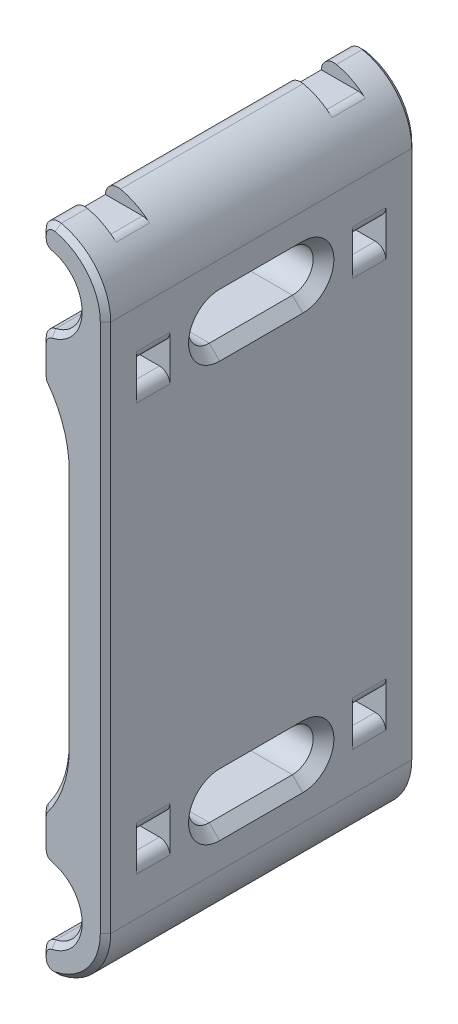
from build123d import *

# Parameters (mm, degrees)
CROQUIS1_R                 = 3.25
SALIENTE_EXTRUIR1_DEPTH    = 30
REDONDEO1_R                = 10
CORTAR_EXTRUIR1_DEPTH      = 46.124827032
CROQUIS3_W                 = 19.168620823
CROQUIS3_H                 = 82.221468015
CORTAR_EXTRUIR2_DEPTH      = 46.124827032
CORTAR_EXTRUIR7_DEPTH      = 44.68352107
CORTAR_EXTRUIR7_DEPTH_BACK = 44.68352107
CROQUIS4_W                 = 3.2
CROQUIS4_H                 = 2.3
REDONDEO2_R                = 1.2
REDONDEO4_R                = 1
CHAMFER1_SIZE              = 0.5
CHAMFER2_SIZE              = 1


with BuildPart() as part:
    # Croquis1 → Saliente-Extruir1 (new body)
    with BuildSketch(Plane.XY):
        with BuildLine():
            Line((-4, 17.433827309), (-8.98691391, 20.296314259))
            ThreePointArc((-8.98691391, 20.296314259), (-9.006535925, 30.69237342), (0, 25.5))
            Line((0, 25.5), (0, -25.5))
            ThreePointArc((0, -25.5), (-9.006535925, -30.69237342), (-8.98691391, -20.296314259))
            Line((-8.98691391, -20.296314259), (-4, -17.433827309))
            Line((-4, -17.433827309), (-4, 17.433827309))
        make_face()
        with Locations((-6, 25.5)):
            Circle(CROQUIS1_R, mode=Mode.SUBTRACT)
        with Locations(Location((-6, -25.5, 0), (0, 0, 180))):
            Circle(CROQUIS1_R, mode=Mode.SUBTRACT)
    extrude(amount=-SALIENTE_EXTRUIR1_DEPTH)

    # Redondeo1
    redondeo1_edges = [part.edges().sort_by_distance(p)[0] for p in [
        (-4, -17.433827309, -15),
        (-4, 17.433827309, -15),
    ]]
    fillet(redondeo1_edges, radius=REDONDEO1_R)

    # Croquis2 → Cortar-Extruir1 (cut, through all)
    with BuildSketch(Plane(origin=(0, 0, 0), x_dir=(0, 0, -1), z_dir=(1, 0, 0))):
        with BuildLine():
            Line((11, 22), (19, 22))
            ThreePointArc((19, 22), (21, 20), (19, 18))
            Line((19, 18), (11, 18))
            ThreePointArc((11, 18), (9, 20), (11, 22))
        make_face()
        with BuildLine():
            Line((11, -22), (19, -22))
            ThreePointArc((19, -22), (21, -20), (19, -18))
            Line((19, -18), (11, -18))
            ThreePointArc((11, -18), (9, -20), (11, -22))
        make_face()
    extrude(amount=-CORTAR_EXTRUIR1_DEPTH, mode=Mode.SUBTRACT)

    # Croquis3 → Cortar-Extruir2 (cut, through all)
    with BuildSketch(Plane(origin=(0, 0, -30), x_dir=(-1, 0, 0), z_dir=(0, 0, -1))):
        with Locations((15.792539244, 3.658464898)):
            Rectangle(CROQUIS3_W, CROQUIS3_H)
    extrude(amount=-CORTAR_EXTRUIR2_DEPTH, mode=Mode.SUBTRACT)

    # Croquis4 → Cortar-Extruir7 (cut, two sides: drawn at the far end of the back side and taken through both)
    with BuildSketch(Plane.ZY.offset(4).offset(-CORTAR_EXTRUIR7_DEPTH_BACK)):
        with Locations((-4.6, 31.35)):
            Rectangle(CROQUIS4_W, CROQUIS4_H)
        with Locations((-25.4, 31.35)):
            Rectangle(CROQUIS4_W, CROQUIS4_H)
        with Locations((-25.4, 19.65)):
            Rectangle(CROQUIS4_W, CROQUIS4_H)
        with Locations((-4.6, 19.65)):
            Rectangle(CROQUIS4_W, CROQUIS4_H)
        with Locations((-4.6, -19.65)):
            Rectangle(CROQUIS4_W, CROQUIS4_H)
        with Locations((-25.4, -19.65)):
            Rectangle(CROQUIS4_W, CROQUIS4_H)
        with Locations((-4.6, -31.35)):
            Rectangle(CROQUIS4_W, CROQUIS4_H)
        with Locations((-25.4, -31.35)):
            Rectangle(CROQUIS4_W, CROQUIS4_H)
    extrude(amount=CORTAR_EXTRUIR7_DEPTH + CORTAR_EXTRUIR7_DEPTH_BACK, mode=Mode.SUBTRACT)

    # Redondeo2
    # the kernel refuses this fillet: 1.2 mm, written as the material it takes off along each edge
    with BuildSketch(Plane(origin=(-6.208228832, 31.496385641, -6.633505757), x_dir=(0.9962436341156765, -0.08659458114680287, 0), z_dir=(0, 0, 1)), Plane(origin=(-6.208228832, 31.496385641, -33.633505757), x_dir=(0.9962436341156765, -0.08659458114680287, 0), z_dir=(0, 0, 1))) as redondeo2_piece_1:
        with BuildLine():
            CenterArc((1.308062073, -1.191165907), REDONDEO2_R, 83.043435968, 101.924289818)
            Line((0.112569712, -1.295079404), (0, 0))
            ThreePointArc((0, 0), (0.726701151, 0.044170466), (1.453402303, 0))
        make_face()
    extrude(amount=10.267011514, mode=Mode.SUBTRACT)
    with BuildSketch(Plane(origin=(-6.208228832, -31.496385641, -33.633505757), x_dir=(0.9962436341156764, 0.08659458114680295, 0), z_dir=(0, 0, 1)), Plane(origin=(-6.208228832, -31.496385641, -6.633505757), x_dir=(0.9962436341156764, 0.08659458114680295, 0), z_dir=(0, 0, 1))) as redondeo2_piece_2:
        with BuildLine():
            CenterArc((1.308062073, 1.191165907), REDONDEO2_R, 175.032274214, 101.924289818)
            Line((0.112569712, 1.295079404), (0, 0))
            ThreePointArc((0, 0), (0.726701151, -0.044170466), (1.453402303, 0))
        make_face()
    extrude(amount=10.267011514, mode=Mode.SUBTRACT)
    with BuildSketch(Plane(origin=(-6.208228832, 28.743322487, -32.736879913), x_dir=(0, 1, 0), z_dir=(0, 0, 1))) as redondeo2_piece_3:
        with BuildLine():
            CenterArc((1.094751965, -1.2), REDONDEO2_R, 90, 77.122346342)
            ThreePointArc((-0.075065865, -0.93255609), (-0.003800627, -0.468993318), (0, 0))
            Line((0, 0), (1.094751965, 0))
        make_face()
    extrude(amount=35.473759826, mode=Mode.SUBTRACT)
    with BuildSketch(Plane(origin=(-6.208228832, 22.256677513, -32.736879913), x_dir=(0, -1, 0), z_dir=(0, 0, 1)), Plane(origin=(-6.208228832, -28.743322487, -32.736879913), x_dir=(0, -1, 0), z_dir=(0, 0, 1))) as redondeo2_piece_4:
        with BuildLine():
            CenterArc((1.094751965, 1.2), REDONDEO2_R, 192.877653658, 77.122346342)
            ThreePointArc((-0.075065865, 0.93255609), (-0.003800627, 0.468993318), (0, 0))
            Line((0, 0), (1.094751965, 0))
        make_face()
    extrude(amount=35.473759826, mode=Mode.SUBTRACT)
    with BuildSketch(Plane(origin=(-6.208228832, 17.911631675, 1.023475891), x_dir=(0.6116158089577609, -0.7911549167090751, 0), z_dir=(0, 0, -1))) as redondeo2_piece_5:
        with BuildLine():
            CenterArc((0.410047777, -1.199775514), REDONDEO2_R, 91.108276989, 36.598151405)
            Line((-0.323891193, -0.250389614), (0, 0))
            ThreePointArc((0, 0), (0.193418763, -0.001870716), (0.386837526, 0))
        make_face()
    extrude(amount=32.046951782, mode=Mode.SUBTRACT)
    with BuildSketch(Plane(origin=(-6.208228832, -22.256677513, -32.736879913), x_dir=(0.9967759569904702, -0.0802352264640189, 0), z_dir=(0, 0, 1))) as redondeo2_piece_6:
        with BuildLine():
            CenterArc((1.108293477, 1.187504709), REDONDEO2_R, 184.602086684, 77.122346342)
            Line((-0.087837672, 1.091222438), (0, 0))
            ThreePointArc((0, 0), (0.467786208, 0.033841412), (0.935572415, 0))
        make_face()
    extrude(amount=35.473759826, mode=Mode.SUBTRACT)
    with BuildSketch(Plane(origin=(-6.208228832, -17.911631675, 1.023475891), x_dir=(0, -1, 0), z_dir=(0, 0, -1))) as redondeo2_piece_7:
        with BuildLine():
            CenterArc((0.409390356, -1.2), REDONDEO2_R, 90, 36.598151405)
            ThreePointArc((-0.306048411, -0.236595946), (-0.151880046, -0.119777999), (0, 0))
            Line((0, 0), (0.409390356, 0))
        make_face()
    extrude(amount=32.046951782, mode=Mode.SUBTRACT)
    with BuildSketch(Plane(origin=(-6.208228832, 31.496385641, -27.433505757), x_dir=(0.9962436341156765, -0.08659458114680287, 0), z_dir=(0, 0, 1))) as redondeo2_piece_8:
        with BuildLine():
            CenterArc((1.308062073, -1.191165907), REDONDEO2_R, 83.043435968, 101.924289818)
            Line((0.112569712, -1.295079404), (0, 0))
            ThreePointArc((0, 0), (0.726701151, 0.044170466), (1.453402303, 0))
        make_face()
    extrude(amount=24.867011514, mode=Mode.SUBTRACT)
    with BuildSketch(Plane(origin=(-6.208228832, -31.496385641, -27.433505757), x_dir=(0.9962436341156764, 0.08659458114680295, 0), z_dir=(0, 0, 1))) as redondeo2_piece_9:
        with BuildLine():
            CenterArc((1.308062073, 1.191165907), REDONDEO2_R, 175.032274214, 101.924289818)
            Line((0.112569712, 1.295079404), (0, 0))
            ThreePointArc((0, 0), (0.726701151, -0.044170466), (1.453402303, 0))
        make_face()
    extrude(amount=24.867011514, mode=Mode.SUBTRACT)

    # Redondeo4
    redondeo4_edges = [part.edges().sort_by_distance(p)[0] for p in [
        (0, -18.5, -25.4),
        (0, -20.8, -25.4),
        (0, -18.5, -4.6),
        (0, -20.8, -4.6),
        (-2.27038876, 30.2, -4.6),
        (0, 18.5, -25.4),
        (0, 20.8, -25.4),
        (0, 18.5, -4.6),
        (0, 20.8, -4.6),
        (-2.27038876, 30.2, -25.4),
    ]]
    fillet(redondeo4_edges, radius=REDONDEO4_R)

    # Chamfer1
    chamfer1_edges = [part.edges().sort_by_distance(p)[0] for p in [
        (0, 0, -30),
        (-4, 0, 0),
        (-4, 0, -30),
        (-6.208228832, -30.017248777, 0),
        (-6.208228832, -30.017248777, -30),
        (-1.339619985, -29.279002265, 0),
        (-6.208228832, 30.017248777, 0),
        (-2.75, 25.5, 0),
        (-6.208228832, 19.74147379, 0),
        (-4.505694572, 14.783364937, 0),
        (-6.208228832, -19.74147379, 0),
        (-2.75, -25.5, 0),
        (-5.946560515, 29.09005463, 0),
        (-5.946560515, 21.90994537, 0),
        (-5.764029285, 31.128499105, 0),
        (-6.147545484, 17.944249464, 0),
        (-6.147545484, -17.944249464, 0),
        (-5.946560515, -21.90994537, 0),
        (-5.946560515, -29.09005463, 0),
        (-5.764029285, -31.128499105, 0),
        (-1.339619985, -29.279002265, -30),
        (-6.208228832, 30.017248777, -30),
        (-2.75, -25.5, -30),
        (-6.208228832, -19.74147379, -30),
        (-4.505694572, -14.783364937, -30),
        (-6.208228832, 19.74147379, -30),
        (-2.75, 25.5, -30),
        (-5.946560515, 29.09005463, -30),
        (-5.946560515, 21.90994537, -30),
        (-6.147545484, 17.944249464, -30),
        (-6.147545484, -17.944249464, -30),
        (-5.946560515, -21.90994537, -30),
        (-5.946560515, -29.09005463, -30),
        (-5.764029285, -31.128499105, -30),
        (-5.764029285, 31.128499105, -30),
        (-4.505694572, -14.783364937, 0),
        (-4.505694572, 14.783364937, -30),
        (-1.339619985, 29.279002265, -30),
        (0, 0, 0),
        (-1.339619985, 29.279002265, 0),
    ]]
    chamfer(chamfer1_edges, length=CHAMFER1_SIZE)

    # Chamfer2
    chamfer2_edges = [part.edges().sort_by_distance(p)[0] for p in [
        (0, 20, -9),
        (0, 18, -15),
        (0, 20, -21),
        (0, 22, -15),
        (0, -20, -9),
        (0, -22, -15),
        (0, -20, -21),
        (0, -18, -15),
    ]]
    chamfer(chamfer2_edges, length=CHAMFER2_SIZE)


solid = part.part
